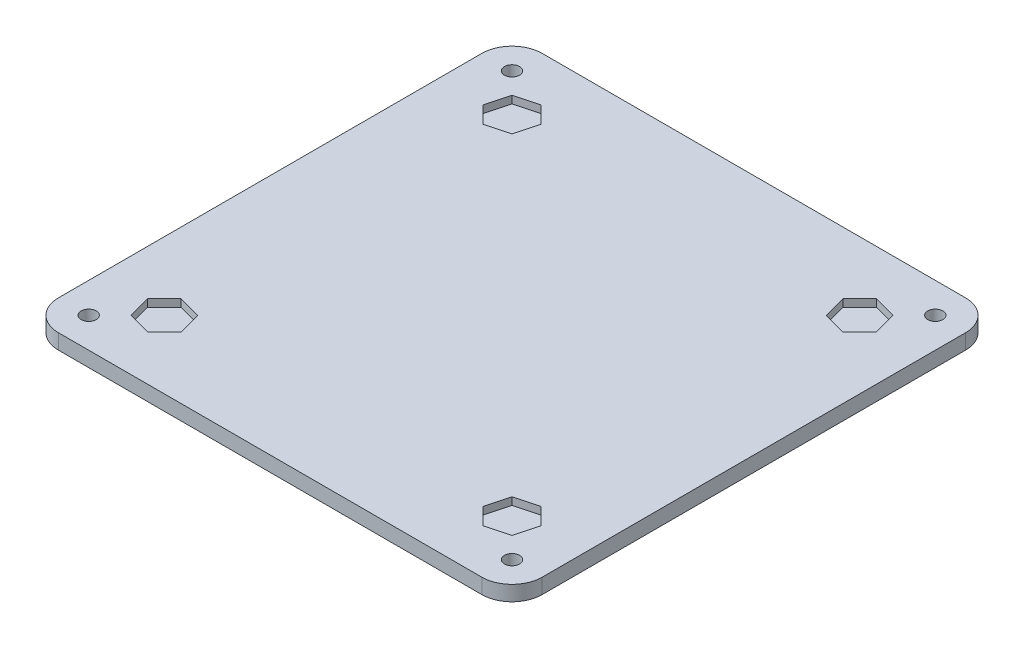
from build123d import *

# Parameters (mm, degrees)
SKETCH1_W           = 203.2
SKETCH1_H           = 203.2
BOSS_EXTRUDE1_DEPTH = 6.35
FILLET1_R           = 12.7
SKETCH2_R           = 3.175
CUT_EXTRUDE1_DEPTH  = 288.438345563
CUT_EXTRUDE2_DEPTH  = 3.175


with BuildPart() as part:
    # Sketch1 → Boss-Extrude1 (new body)
    with BuildSketch(Plane(origin=(0, 0, 0), x_dir=(1, 0, 0), z_dir=(0, 1, 0))):
        with Locations((101.6, 101.6)):
            Rectangle(SKETCH1_W, SKETCH1_H)
    extrude(amount=BOSS_EXTRUDE1_DEPTH)

    # Fillet1
    fillet1_edges = [part.edges().sort_by_distance(p)[0] for p in [
        (0, 3.175, -203.2),
        (0, 3.175, 0),
        (203.2, 3.175, 0),
        (203.2, 3.175, -203.2),
    ]]
    fillet(fillet1_edges, radius=FILLET1_R)

    # Sketch2 → Cut-Extrude1 (cut, through all)
    with BuildSketch(Plane.XZ):
        with Locations((12.7, -12.7)):
            Circle(SKETCH2_R)
        with Locations((190.5, -12.7)):
            Circle(SKETCH2_R)
        with Locations((190.5, -190.5)):
            Circle(SKETCH2_R)
        with Locations((12.7, -190.5)):
            Circle(SKETCH2_R)
    extrude(amount=-CUT_EXTRUDE1_DEPTH, mode=Mode.SUBTRACT)

    # Sketch22 → Cut-Extrude2 (cut)
    with BuildSketch(Plane(origin=(0, 6.35, 0), x_dir=(1, 0, 0), z_dir=(0, 1, 0))):
        Polygon((181.654219065, 181.654219065), (172.052127253, 184.227091812), (165.022908188, 177.197872747), (167.595780935, 167.595780935), (177.197872747, 165.022908188), (184.227091812, 172.052127253), align=None)
        Polygon((18.972908188, 172.052127253), (21.545780935, 181.654219065), (31.147872747, 184.227091812), (38.177091812, 177.197872747), (35.604219065, 167.595780935), (26.002127253, 165.022908188), align=None)
        Polygon((184.227091812, 31.147872747), (181.654219065, 21.545780935), (172.052127253, 18.972908188), (165.022908188, 26.002127253), (167.595780935, 35.604219065), (177.197872747, 38.177091812), align=None)
        Polygon((21.545780935, 21.545780935), (31.147872747, 18.972908188), (38.177091812, 26.002127253), (35.604219065, 35.604219065), (26.002127253, 38.177091812), (18.972908188, 31.147872747), align=None)
    extrude(amount=-CUT_EXTRUDE2_DEPTH, mode=Mode.SUBTRACT)


solid = part.part
